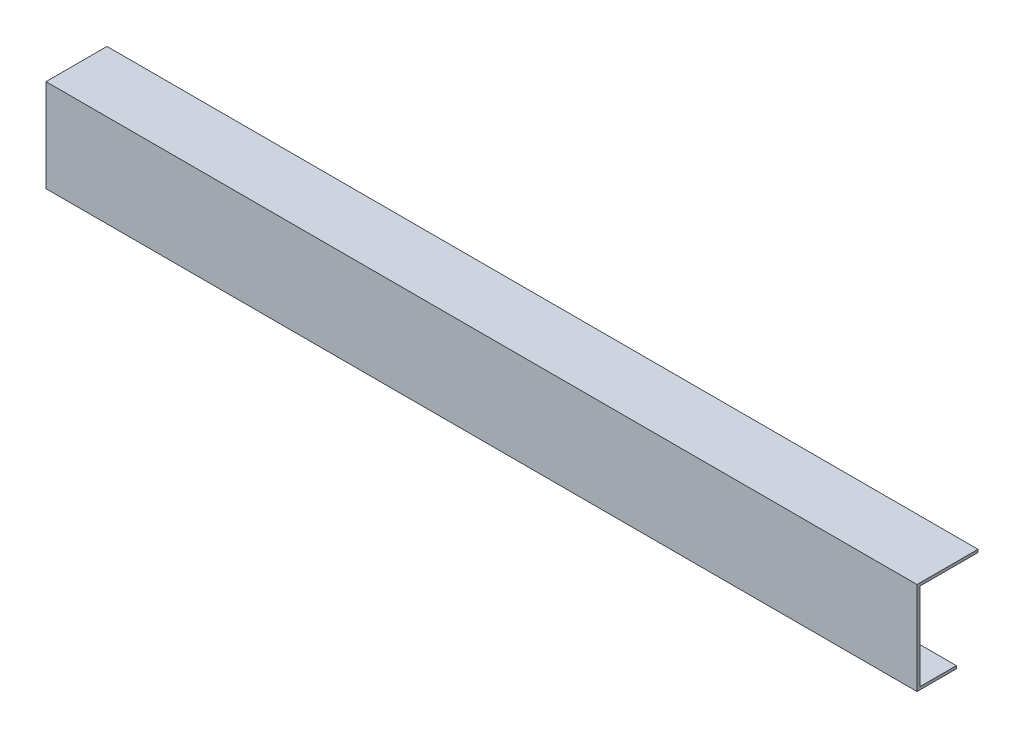
from build123d import *

# Parameters (mm, degrees)
SKETCH1_W           = 787.4
SKETCH1_H           = 83.82
BOSS_EXTRUDE1_DEPTH = 55.118
CUT_EXTRUDE1_DEPTH  = 794.764792822


with BuildPart() as part:
    # Sketch1 → Boss-Extrude1 (new body)
    with BuildSketch(Plane.XY):
        with Locations((393.7, -41.91)):
            Rectangle(SKETCH1_W, SKETCH1_H)
    extrude(amount=BOSS_EXTRUDE1_DEPTH)

    # Sketch2 → Cut-Extrude1 (cut, through all)
    with BuildSketch(Plane(origin=(787.4, 0, 0), x_dir=(0, 0, -1), z_dir=(1, 0, 0))):
        Polygon((-19.558, -83.82), (-19.558, -81.28), (-52.578, -81.28), (-52.578, -2.54), (0, -2.54), (0, -83.82), align=None)
    extrude(amount=-CUT_EXTRUDE1_DEPTH, mode=Mode.SUBTRACT)


solid = part.part
